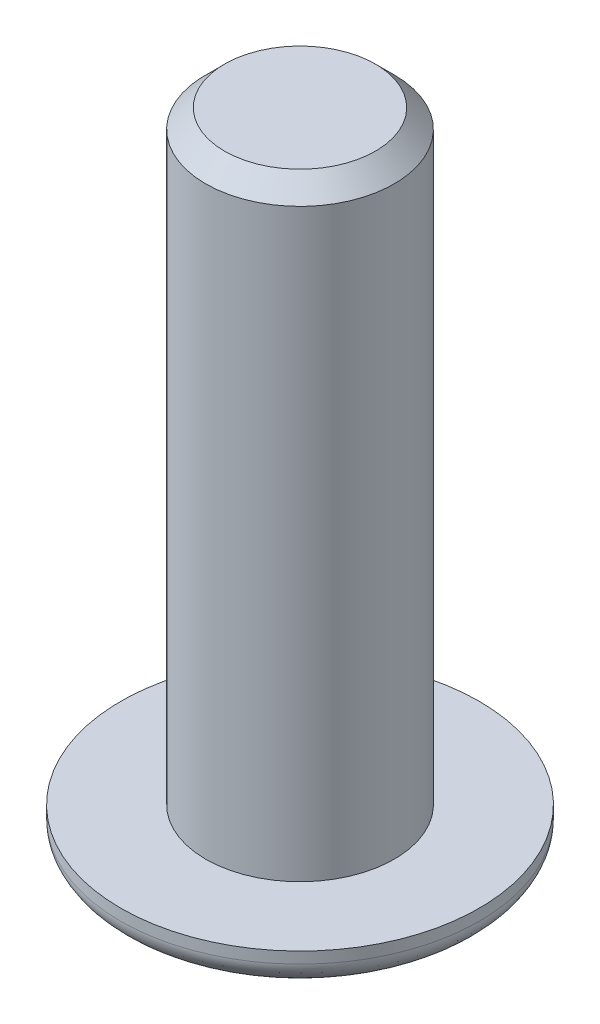
from build123d import *

# Parameters (mm, degrees)
SKETCH_1_R      = 4.75
EXTRUDE_1_DEPTH = 1.3
SKETCH_2_R      = 2.5
EXTRUDE_2_DEPTH = 16
CHAMFER_1_SIZE  = 0.5
FILLET_1_SIZE   = 1
FILLET_1_SIZE_2 = 2


with BuildPart() as part:
    # 草图1 → 凸台-拉伸1 (new body)
    with BuildSketch(Plane(origin=(0, 0, 0), x_dir=(1, 0, 0), z_dir=(0, 1, 0))):
        with Locations(Location((0, 0, 0), (0, 0, 270))):
            Circle(SKETCH_1_R)
        Polygon((0, -1.732050808), (1.5, -0.866025404), (1.5, 0.866025404), (0, 1.732050808), (-1.5, 0.866025404), (-1.5, -0.866025404), align=None, mode=Mode.SUBTRACT)
    extrude(amount=EXTRUDE_1_DEPTH)

    # 草图2 → 凸台-拉伸2 (add)
    with BuildSketch(Plane(origin=(0, 1.3, 0), x_dir=(1, 0, 0), z_dir=(0, 1, 0))):
        with Locations(Location((0, 0, 0), (0, 0, 270))):
            Circle(SKETCH_2_R)
    extrude(amount=EXTRUDE_2_DEPTH)

    # 倒角1
    chamfer_1_edges = [part.edges().sort_by_distance(p)[0] for p in [
        (0, 17.3, -2.5),
    ]]
    chamfer(chamfer_1_edges, length=CHAMFER_1_SIZE)

    # 圆角1
    # an asymmetric fillet: 2, 1 mm, written as the material it takes off along each edge
    with BuildSketch(Plane(origin=(0, 0, 0), x_dir=(0, 0, 1), z_dir=(-1, 0, 0))) as fillet_1_piece_1:
        with BuildLine():
            Bezier((4.75, FILLET_1_SIZE), (4.75, 0), (4.75 - FILLET_1_SIZE_2, 0), weights=[1, 0.707106781, 1])
            Line((4.75 - FILLET_1_SIZE_2, 0), (4.75, 0))
            Line((4.75, 0), (4.75, FILLET_1_SIZE))
        make_face()
    revolve(axis=Axis((0, 0, 0), (0, 1, 0)), mode=Mode.SUBTRACT)


solid = part.part
